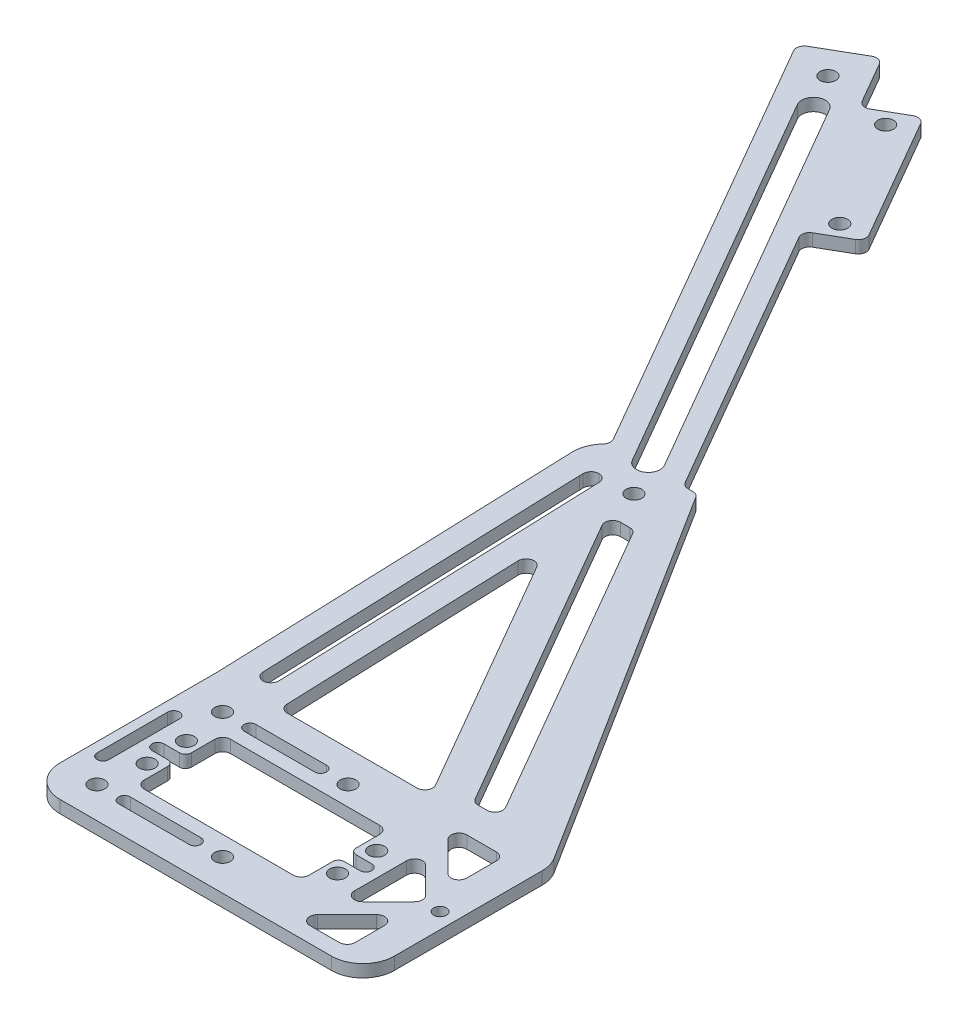
from build123d import *

# Parameters (mm, degrees)
SKETCH1_R           = 1.621
SKETCH1_R_2         = 2
BOSS_EXTRUDE1_DEPTH = 3.18
FILLET1_R           = 8
FILLET2_R           = 2
FILLET3_START       = -1
FILLET3_DEPTH       = 5
FILLET3_2_DEPTH     = 3.18


with BuildPart() as part:
    # Sketch1 → Boss-Extrude1 (new body)
    with BuildSketch(Plane(origin=(0, 0, 0), x_dir=(1, 0, 0), z_dir=(0, 1, 0))):
        Polygon((191.702370632, -73.75247875), (106.473615386, -73.75247875), (106.473615386, -25.75247875), (102.881862556, 74.825269893), (106.345964171, 74.825269893), (41.774167402, 186.666902634), (55.630573862, 194.666902634), (63.630573862, 180.810496174), (74.022878708, 186.810496174), (94.022878708, 152.169480022), (83.630573862, 146.169480022), (124.821172785, 74.825269893), (128.285274401, 74.825269893), (191.702370632, -25.75247875), align=None)
        with Locations(Location((187.702370632, -50.088159618, 0), (0, 0, 90))):
            Circle(SKETCH1_R, mode=Mode.SUBTRACT)
        with Locations(Location((117.723615386, -44.75247875, 0), (0, 0, 90))):
            Circle(SKETCH1_R_2, mode=Mode.SUBTRACT)
        with Locations(Location((117.723615386, -54.75247875, 0), (0, 0, 90))):
            Circle(SKETCH1_R_2, mode=Mode.SUBTRACT)
        with Locations(Location((166.223615386, -44.75247875, 0), (0, 0, 90))):
            Circle(SKETCH1_R_2, mode=Mode.SUBTRACT)
        with Locations(Location((166.223615386, -54.75247875, 0), (0, 0, 90))):
            Circle(SKETCH1_R_2, mode=Mode.SUBTRACT)
        with Locations(Location((115.923615386, -33.75247875, 0), (0, 0, 90))):
            Circle(SKETCH1_R_2, mode=Mode.SUBTRACT)
        with Locations(Location((147.923615386, -33.75247875, 0), (0, 0, 90))):
            Circle(SKETCH1_R_2, mode=Mode.SUBTRACT)
        with Locations(Location((147.923615386, -65.75247875, 0), (0, 0, 90))):
            Circle(SKETCH1_R_2, mode=Mode.SUBTRACT)
        with Locations(Location((115.923615386, -65.75247875, 0), (0, 0, 90))):
            Circle(SKETCH1_R_2, mode=Mode.SUBTRACT)
        with Locations(Location((120.202370632, 66.825269893, 0), (0, 0, 90))):
            Circle(SKETCH1_R_2, mode=Mode.SUBTRACT)
        with Locations(Location((52.702370632, 183.738699404, 0), (0, 0, 90))):
            Circle(SKETCH1_R_2, mode=Mode.SUBTRACT)
        with Locations(Location((70.826726285, 180.346394558, 0), (0, 0, 90))):
            Circle(SKETCH1_R_2, mode=Mode.SUBTRACT)
        with Locations(Location((86.826726285, 152.633581637, 0), (0, 0, 90))):
            Circle(SKETCH1_R_2, mode=Mode.SUBTRACT)
        with BuildLine():
            Line((122.923615386, -64.25247875), (140.923615386, -64.25247875))
            ThreePointArc((140.923615386, -64.25247875), (142.423615386, -65.75247875), (140.923615386, -67.25247875))
            Line((140.923615386, -67.25247875), (122.923615386, -67.25247875))
            ThreePointArc((122.923615386, -67.25247875), (121.423615386, -65.75247875), (122.923615386, -64.25247875))
        make_face(mode=Mode.SUBTRACT)
        with BuildLine():
            Line((122.923615386, -35.25247875), (140.923615386, -35.25247875))
            ThreePointArc((140.923615386, -35.25247875), (142.423615386, -33.75247875), (140.923615386, -32.25247875))
            Line((140.923615386, -32.25247875), (122.923615386, -32.25247875))
            ThreePointArc((122.923615386, -32.25247875), (121.423615386, -33.75247875), (122.923615386, -35.25247875))
        make_face(mode=Mode.SUBTRACT)
        Polygon((162.973615386, -60.75247875), (120.973615386, -60.75247875), (120.973615386, -51.25247875), (113.973615386, -51.25247875), (113.973615386, -48.25247875), (120.973615386, -48.25247875), (120.973615386, -38.75247875), (162.973615386, -38.75247875), (162.973615386, -48.25247875), (169.973615386, -48.25247875), (169.973615386, -51.25247875), (162.973615386, -51.25247875), align=None, mode=Mode.SUBTRACT)
        with BuildLine():
            Line((111.973615386, -40.75247875), (111.973615386, -58.75247875))
            ThreePointArc((111.973615386, -58.75247875), (110.473615386, -60.25247875), (108.973615386, -58.75247875))
            Line((108.973615386, -58.75247875), (108.973615386, -40.75247875))
            ThreePointArc((108.973615386, -40.75247875), (110.473615386, -39.25247875), (111.973615386, -40.75247875))
        make_face(mode=Mode.SUBTRACT)
        Polygon((169.359224881, -69.75247875), (183.702370632, -55.409333), (183.702370632, -69.75247875), align=None, mode=Mode.SUBTRACT)
        Polygon((183.702370632, -44.095624501), (183.702370632, -29.75247875), (169.359224881, -29.75247875), align=None, mode=Mode.SUBTRACT)
        Polygon((172.223615386, -38.273723504), (172.223615386, -61.231233997), (183.702370632, -49.75247875), align=None, mode=Mode.SUBTRACT)
        Polygon((160.95045281, -25.75247875), (119.947641954, 45.266472905), (122.483814458, -25.75247875), align=None, mode=Mode.SUBTRACT)
        Polygon((121.35707117, 58.825269893), (128.285274401, 58.825269893), (174.80685927, -21.75247875), (167.87865604, -21.75247875), align=None, mode=Mode.SUBTRACT)
        Polygon((112.334595208, -21.75247875), (109.278510488, 63.825269893), (109.278510488, 66.825269893), (113.173926634, 66.825269893), (116.230011355, -18.75247875), (116.230011355, -21.75247875), align=None, mode=Mode.SUBTRACT)
        with BuildLine():
            Line((60.300446843, 176.578445366), (117.800446843, 76.985523931))
            ThreePointArc((117.800446843, 76.985523931), (116.702370632, 72.887447719), (112.60429442, 73.985523931))
            Line((112.60429442, 73.985523931), (55.10429442, 173.578445366))
            ThreePointArc((55.10429442, 173.578445366), (56.202370632, 177.676521577), (60.300446843, 176.578445366))
        make_face(mode=Mode.SUBTRACT)
    extrude(amount=BOSS_EXTRUDE1_DEPTH)

    # Fillet1
    # the kernel refuses this fillet: 8 mm, written as the material it adds along each edge
    with BuildSketch(Plane(origin=(106.473615386, 0, 25.75247875), x_dir=(0, 0, 1), z_dir=(0, 1, 0))) as fillet1_piece_1:
        with BuildLine():
            CenterArc((FILLET1_R * 0.017849914497, -FILLET1_R), FILLET1_R, 90, 2.045232332)
            Line((-FILLET1_R * 0.0178385434602, -FILLET1_R * 0.000637035923067), (0, 0))
            Line((0, 0), (FILLET1_R * 0.017849914497, 0))
        make_face()
    extrude(amount=3.18)
    # the kernel refuses this fillet: 8 mm, written as the material it takes off along each edge
    with BuildSketch(Plane(origin=(106.473615386, -20, 73.75247875), x_dir=(1, 0, 0), z_dir=(0, 1, 0))) as fillet1_2_piece_1:
        with BuildLine():
            CenterArc((FILLET1_R, FILLET1_R), FILLET1_R, 180, 90)
            Line((0, FILLET1_R), (0, 0))
            Line((0, 0), (FILLET1_R, 0))
        make_face()
    extrude(amount=43.18, mode=Mode.SUBTRACT)
    with BuildSketch(Plane(origin=(191.702370632, -20, 73.75247875), x_dir=(-1, 0, 0), z_dir=(0, 1, 0))) as fillet1_2_piece_2:
        with BuildLine():
            CenterArc((FILLET1_R, -FILLET1_R), FILLET1_R, 90, 90)
            Line((0, -FILLET1_R), (0, 0))
            Line((0, 0), (FILLET1_R, 0))
        make_face()
    extrude(amount=43.18, mode=Mode.SUBTRACT)
    with BuildSketch(Plane(origin=(102.881862556, -16.779803055, -74.825269893), x_dir=(0.035688457957243624, 0, 0.9993629640769333), z_dir=(0, 1, 0))) as fillet1_2_piece_3:
        with BuildLine():
            CenterArc((6.711921222, 8), FILLET1_R, 214.559596033, 55.440403967)
            Line((0.123628445, 3.461894858), (0, 0))
            Line((0, 0), (6.711921222, 0))
        make_face()
    extrude(amount=36.739606111, mode=Mode.SUBTRACT)
    with BuildSketch(Plane(origin=(191.702370632, -5.778864476, 25.75247875), x_dir=(0, 0, 1), z_dir=(0, 1, 0))) as fillet1_2_piece_4:
        with BuildLine():
            CenterArc((FILLET1_R * 0.288943223791, -FILLET1_R), FILLET1_R, 90, 32.232583101)
            Line((-FILLET1_R * 0.244414181248, -FILLET1_R * 0.154110008044), (0, 0))
            Line((0, 0), (FILLET1_R * 0.288943223791, 0))
        make_face()
    extrude(amount=14.737728952, mode=Mode.SUBTRACT)

    # Fillet2
    # the kernel refuses this fillet: 2 mm, written as the material it adds along each edge
    with BuildSketch(Plane(origin=(162.973615386, 0, 60.75247875), x_dir=(0, 0, -1), z_dir=(0, 1, 0)), Plane(origin=(120.973615386, 0, 60.75247875), x_dir=(1, 0, 0), z_dir=(0, 1, 0)), Plane(origin=(183.702370632, 0, 49.75247875), x_dir=(-0.7071067811865476, 0, -0.7071067811865476), z_dir=(0, 1, 0)), Plane(origin=(109.278510488, 0, -66.825269893), x_dir=(0, 0, 1), z_dir=(0, 1, 0)), Plane(origin=(83.630573862, 0, -146.169480022), x_dir=(0.5000000000000021, 0, 0.8660254037844375), z_dir=(0, 1, 0)), Plane(origin=(63.630573862, 0, -180.810496174), x_dir=(0.8660254037844402, 0, -0.49999999999999745), z_dir=(0, 1, 0))) as fillet2_piece_1:
        with BuildLine():
            CenterArc((FILLET2_R, FILLET2_R), FILLET2_R, 180, 90)
            Line((0, FILLET2_R), (0, 0))
            Line((0, 0), (FILLET2_R, 0))
        make_face()
    extrude(amount=3.18)
    with BuildSketch(Plane(origin=(172.223615386, 0, 38.273723504), x_dir=(0, 0, 1), z_dir=(0, 1, 0)), Plane(origin=(169.359224881, 0, 69.75247875), x_dir=(1, 0, 0), z_dir=(0, 1, 0)), Plane(origin=(169.359224881, 0, 29.75247875), x_dir=(0.7071067811865468, 0, 0.7071067811865482), z_dir=(0, 1, 0)), Plane(origin=(183.702370632, 0, 44.095624501), x_dir=(0, 0, -1), z_dir=(0, 1, 0))) as fillet2_piece_2:
        with BuildLine():
            CenterArc((FILLET2_R * 2.41421356237, FILLET2_R), FILLET2_R, 135, 135)
            Line((FILLET2_R * 1.70710678119, FILLET2_R * 1.70710678119), (0, 0))
            Line((0, 0), (FILLET2_R * 2.41421356237, 0))
        make_face()
    extrude(amount=3.18)
    with BuildSketch(Plane(origin=(172.223615386, 0, 61.231233997), x_dir=(0, 0, -1), z_dir=(0, 1, 0)), Plane(origin=(183.702370632, 0, 55.409333), x_dir=(0, 0, 1), z_dir=(0, 1, 0))) as fillet2_piece_3:
        with BuildLine():
            CenterArc((FILLET2_R * 2.41421356237, -FILLET2_R), FILLET2_R, 90, 135)
            Line((FILLET2_R * 1.70710678119, -FILLET2_R * 1.70710678119), (0, 0))
            Line((0, 0), (FILLET2_R * 2.41421356237, 0))
        make_face()
    extrude(amount=3.18)
    with BuildSketch(Plane(origin=(183.702370632, 0, 69.75247875), x_dir=(-1, 0, 0), z_dir=(0, 1, 0)), Plane(origin=(183.702370632, 0, 29.75247875), x_dir=(0, 0, 1), z_dir=(0, 1, 0)), Plane(origin=(116.230011355, 0, 21.75247875), x_dir=(-1, 0, 0), z_dir=(0, 1, 0)), Plane(origin=(162.973615386, 0, 38.75247875), x_dir=(0, 0, 1), z_dir=(0, 1, 0)), Plane(origin=(120.973615386, 0, 38.75247875), x_dir=(1, 0, 0), z_dir=(0, 1, 0))) as fillet2_piece_4:
        with BuildLine():
            CenterArc((FILLET2_R, -FILLET2_R), FILLET2_R, 90, 90)
            Line((0, -FILLET2_R), (0, 0))
            Line((0, 0), (FILLET2_R, 0))
        make_face()
    extrude(amount=3.18)
    with BuildSketch(Plane(origin=(174.80685927, 0, 21.75247875), x_dir=(-1, 0, 0), z_dir=(0, 1, 0))) as fillet2_piece_5:
        with BuildLine():
            CenterArc((FILLET2_R * 1.73205080757, -FILLET2_R), FILLET2_R, 90, 120)
            Line((FILLET2_R * 0.866025403784, -FILLET2_R * 1.5), (0, 0))
            Line((0, 0), (FILLET2_R * 1.73205080757, 0))
        make_face()
    extrude(amount=3.18)
    with BuildSketch(Plane(origin=(167.87865604, 0, 21.75247875), x_dir=(-0.5000000000000006, 0, -0.8660254037844382), z_dir=(0, 1, 0))) as fillet2_piece_6:
        with BuildLine():
            CenterArc((FILLET2_R * 0.57735026919, -FILLET2_R), FILLET2_R, 90, 60)
            Line((-FILLET2_R * 0.288675134595, -FILLET2_R * 0.5), (0, 0))
            Line((0, 0), (FILLET2_R * 0.57735026919, 0))
        make_face()
    extrude(amount=3.18)
    with BuildSketch(Plane(origin=(128.285274401, 0, -58.825269893), x_dir=(-1, 0, 0), z_dir=(0, 1, 0)), Plane(origin=(124.821172785, 0, -74.825269893), x_dir=(1, 0, 0), z_dir=(0, 1, 0))) as fillet2_piece_7:
        with BuildLine():
            CenterArc((FILLET2_R * 0.57735026919, FILLET2_R), FILLET2_R, 210, 60)
            Line((-FILLET2_R * 0.288675134595, FILLET2_R * 0.5), (0, 0))
            Line((0, 0), (FILLET2_R * 0.57735026919, 0))
        make_face()
    extrude(amount=3.18)
    with BuildSketch(Plane(origin=(121.35707117, 0, -58.825269893), x_dir=(0.49999999999999883, 0, 0.8660254037844393), z_dir=(0, 1, 0)), Plane(origin=(160.95045281, 0, 25.75247875), x_dir=(-0.4999999999999975, 0, -0.86602540378444), z_dir=(0, 1, 0))) as fillet2_piece_8:
        with BuildLine():
            CenterArc((FILLET2_R * 1.73205080757, FILLET2_R), FILLET2_R, 150, 120)
            Line((FILLET2_R * 0.866025403784, FILLET2_R * 1.5), (0, 0))
            Line((0, 0), (FILLET2_R * 1.73205080757, 0))
        make_face()
    extrude(amount=3.18)
    with BuildSketch(Plane(origin=(113.173926634, 0, -66.825269893), x_dir=(0.035688457957253714, 0, 0.9993629640769329), z_dir=(0, 1, 0))) as fillet2_piece_9:
        with BuildLine():
            CenterArc((FILLET2_R * 0.964926234717, -FILLET2_R), FILLET2_R, 90, 87.954767668)
            Line((-FILLET2_R * 0.0344367293596, -FILLET2_R * 0.964311542043), (0, 0))
            Line((0, 0), (FILLET2_R * 0.964926234717, 0))
        make_face()
    extrude(amount=3.18)
    with BuildSketch(Plane(origin=(112.334595208, 0, 21.75247875), x_dir=(1, 0, 0), z_dir=(0, 1, 0)), Plane(origin=(122.483814458, 0, 25.75247875), x_dir=(1, 0, 0), z_dir=(0, 1, 0))) as fillet2_piece_10:
        with BuildLine():
            CenterArc((FILLET2_R * 0.964926234717, FILLET2_R), FILLET2_R, 182.045232332, 87.954767668)
            Line((-FILLET2_R * 0.0344367293596, FILLET2_R * 0.964311542043), (0, 0))
            Line((0, 0), (FILLET2_R * 0.964926234717, 0))
        make_face()
    extrude(amount=3.18)
    with BuildSketch(Plane(origin=(119.947641954, 0, -45.266472905), x_dir=(0.49999999999999856, 0, 0.8660254037844396), z_dir=(0, 1, 0))) as fillet2_piece_11:
        with BuildLine():
            CenterArc((FILLET2_R * 4.01753606997, -FILLET2_R), FILLET2_R, 90, 152.045232332)
            Line((FILLET2_R * 3.54876169915, -FILLET2_R * 1.88331794347), (0, 0))
            Line((0, 0), (FILLET2_R * 4.01753606997, 0))
        make_face()
    extrude(amount=3.18)
    with BuildSketch(Plane(origin=(106.345964171, 0, -74.825269893), x_dir=(-0.745571620776348, 0, 0.666425508435061), z_dir=(0, 1, 0))) as fillet2_piece_12:
        with BuildLine():
            CenterArc((1.6273039, -1.991810027), FILLET2_R, 95.186951293, 73.021269049)
            Line((-0.330489536, -1.583098808), (0, 0))
            ThreePointArc((0, 0), (0.723246178, -0.03275989), (1.446492356, 0))
        make_face()
    extrude(amount=3.18)
    # the kernel refuses this fillet: 2 mm, written as the material it takes off along each edge
    with BuildSketch(Plane(origin=(128.285274401, -2.758293628, -74.825269893), x_dir=(0.5333574050383131, 0, 0.8458899919556897), z_dir=(0, 1, 0))) as fillet2_2_piece_1:
        with BuildLine():
            CenterArc((FILLET2_R * 0.551658725602, -FILLET2_R), FILLET2_R, 90, 57.767416899)
            Line((-FILLET2_R * 0.294231266354, -FILLET2_R * 0.466642594962), (0, 0))
            Line((0, 0), (FILLET2_R * 0.551658725602, 0))
        make_face()
    extrude(amount=8.696587256, mode=Mode.SUBTRACT)
    with BuildSketch(Plane(origin=(41.774167402, -5, -186.666902634), x_dir=(0.8660254037844384, 0, -0.5000000000000006), z_dir=(0, 1, 0)), Plane(origin=(94.022878708, -5, -152.169480022), x_dir=(-0.8660254037844393, 0, 0.499999999999999), z_dir=(0, 1, 0)), Plane(origin=(74.022878708, -5, -186.810496174), x_dir=(0.5000000000000021, 0, 0.8660254037844375), z_dir=(0, 1, 0)), Plane(origin=(55.630573862, -5, -194.666902634), x_dir=(0.49999999999999756, 0, 0.8660254037844402), z_dir=(0, 1, 0))) as fillet2_2_piece_2:
        with BuildLine():
            CenterArc((FILLET2_R, -FILLET2_R), FILLET2_R, 90, 90)
            Line((0, -FILLET2_R), (0, 0))
            Line((0, 0), (FILLET2_R, 0))
        make_face()
    extrude(amount=13.18, mode=Mode.SUBTRACT)

    # Fillet3: read off the stored shape, not the designer's step
    # Fillet3 outline → Fillet3 (cut)
    with BuildSketch(Plane(origin=(0, 0, 0), x_dir=(1, 0, 0), z_dir=(0, 1, 0)).offset(FILLET3_START)):
        with BuildLine():
            Line((120.973615386, -48.25247875), (120.973615386, -46.75247875))
            ThreePointArc((120.973615386, -46.75247875), (120.534275557, -47.813138921), (119.473615386, -48.25247875))
            Line((119.473615386, -48.25247875), (120.973615386, -48.25247875))
        make_face()
        with BuildLine():
            Line((120.973615386, -51.25247875), (119.473615386, -51.25247875))
            ThreePointArc((119.473615386, -51.25247875), (120.534275557, -51.691818579), (120.973615386, -52.75247875))
            Line((120.973615386, -52.75247875), (120.973615386, -51.25247875))
        make_face()
        with BuildLine():
            ThreePointArc((162.973615386, -52.75247875), (163.412955215, -51.691818578), (164.473615386, -51.25247875))
            Line((164.473615386, -51.25247875), (162.973615386, -51.25247875))
            Line((162.973615386, -51.25247875), (162.973615386, -52.75247875))
        make_face()
        with BuildLine():
            Line((162.973615386, -48.25247875), (164.473615386, -48.25247875))
            ThreePointArc((164.473615386, -48.25247875), (163.412955214, -47.813138922), (162.973615386, -46.75247875))
            Line((162.973615386, -46.75247875), (162.973615386, -48.25247875))
        make_face()
    extrude(amount=FILLET3_DEPTH, mode=Mode.SUBTRACT)

    # Fillet3 2 outline → Fillet3 2 (add)
    with BuildSketch(Plane(origin=(0, 0, 0), x_dir=(1, 0, 0), z_dir=(0, 1, 0))):
        with BuildLine():
            ThreePointArc((115.473615386, -51.25247875), (114.412955214, -50.813138922), (113.973615386, -49.75247875))
            Line((113.973615386, -49.75247875), (113.973615386, -51.25247875))
            Line((113.973615386, -51.25247875), (115.473615386, -51.25247875))
        make_face()
        with BuildLine():
            ThreePointArc((113.973615386, -49.75247875), (114.412955215, -48.691818578), (115.473615386, -48.25247875))
            Line((115.473615386, -48.25247875), (113.973615386, -48.25247875))
            Line((113.973615386, -48.25247875), (113.973615386, -49.75247875))
        make_face()
        with BuildLine():
            ThreePointArc((168.473615386, -48.25247875), (169.534275557, -48.691818579), (169.973615386, -49.75247875))
            Line((169.973615386, -49.75247875), (169.973615386, -48.25247875))
            Line((169.973615386, -48.25247875), (168.473615386, -48.25247875))
        make_face()
        with BuildLine():
            ThreePointArc((169.973615386, -49.75247875), (169.534275557, -50.813138921), (168.473615386, -51.25247875))
            Line((168.473615386, -51.25247875), (169.973615386, -51.25247875))
            Line((169.973615386, -51.25247875), (169.973615386, -49.75247875))
        make_face()
    extrude(amount=FILLET3_2_DEPTH)


solid = part.part
